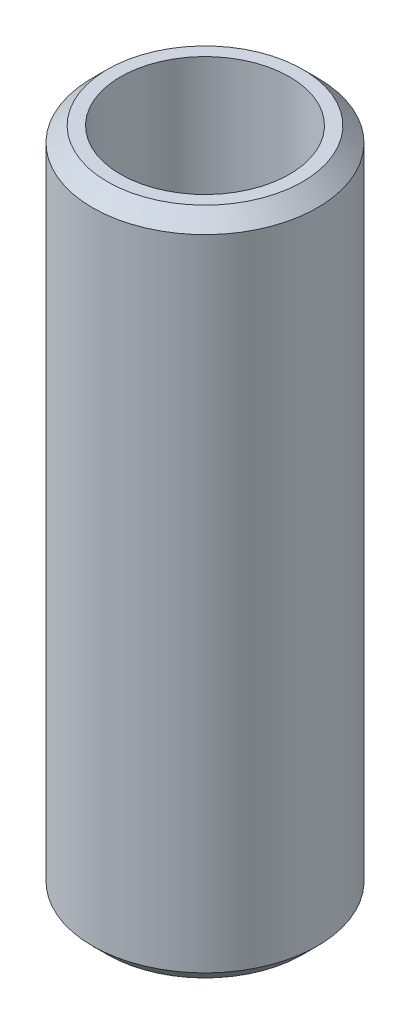
from build123d import *

# Parameters (mm, degrees)
SKETCH1_R           = 35
BOSS_EXTRUDE1_DEPTH = 208.298471464
SKETCH2_R           = 26.299390538
CUT_EXTRUDE1_DEPTH  = 215.098699702
CHAMFER1_SIZE       = 4.655244891


with BuildPart() as part:
    # Sketch1 → Boss-Extrude1 (new body)
    with BuildSketch(Plane(origin=(0, 0, 0), x_dir=(1, 0, 0), z_dir=(0, 1, 0))):
        Circle(SKETCH1_R)
    extrude(amount=BOSS_EXTRUDE1_DEPTH)

    # Sketch2 → Cut-Extrude1 (cut, through all)
    with BuildSketch(Plane(origin=(0, 0, 0), x_dir=(1, 0, 0), z_dir=(0, 1, 0))):
        Circle(SKETCH2_R)
    extrude(amount=CUT_EXTRUDE1_DEPTH, mode=Mode.SUBTRACT)

    # Chamfer1
    chamfer1_edges = [part.edges().sort_by_distance(p)[0] for p in [
        (-35, 208.298471464, 0),
        (-35, 0, 0),
    ]]
    chamfer(chamfer1_edges, length=CHAMFER1_SIZE)


solid = part.part
